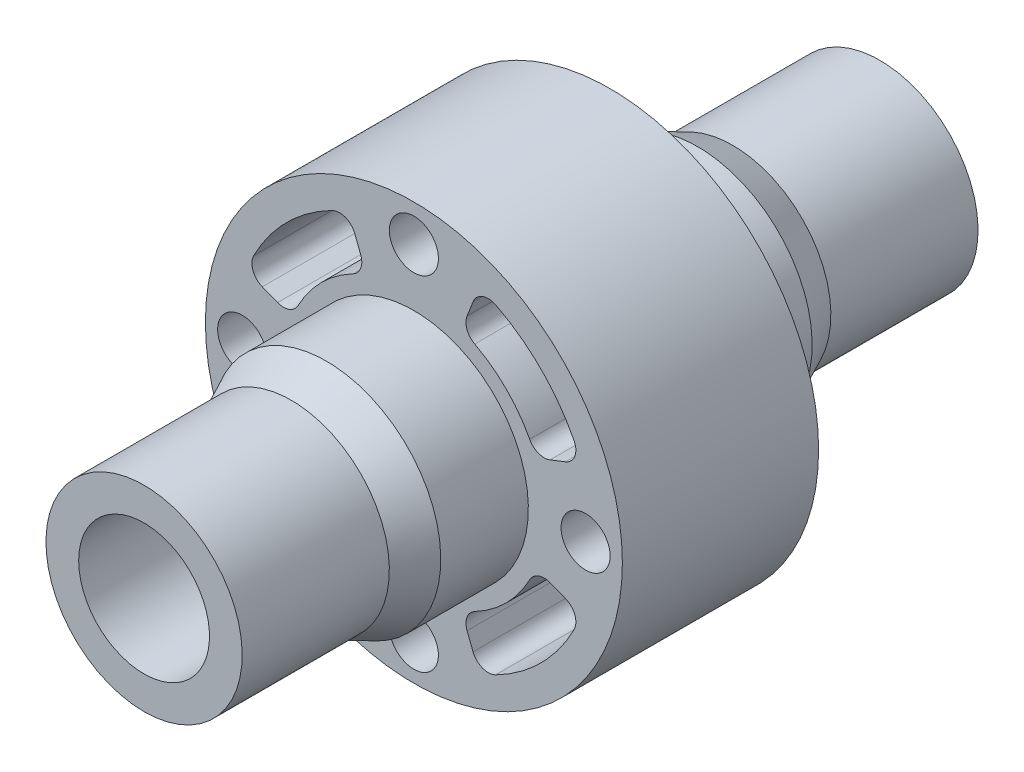
from build123d import *

# Parameters (mm, degrees)
SKETCH_2_R          = 1.5
CUT_EXTRUDE_1_DEPTH = 35.702305399
SKETCH_4_R          = 14
SKETCH_4_R_2        = 12.75
CUT_EXTRUDE_4_DEPTH = 35.702305399
CUT_EXTRUDE_5_DEPTH = 34.724990734
SKETCH_6_R          = 4
CUT_EXTRUDE_6_DEPTH = 49.478087834


with BuildPart() as part:
    # 草图1 → 旋转1 (revolve)
    with BuildSketch(Plane(origin=(0, 0, 0), x_dir=(0, 0, -1), z_dir=(1, 0, 0))):
        Polygon((-22.5, 0), (-22.5, 6), (-13.5, 6), (-11.355493079, 7), (-6, 7), (-6, 14), (6, 14), (6, 7), (11.355493079, 7), (13.5, 6), (22.5, 6), (22.5, 0), align=None)
    revolve(axis=Axis((0, 0, 22.5), (0, 0, -1)))

    # 草图2 → 切除-拉伸1 (cut, through all)
    with BuildSketch(Plane.XY.offset(6)):
        with Locations((0, 10.5)):
            Circle(SKETCH_2_R)
        with Locations((10.5, 0)):
            Circle(SKETCH_2_R)
        with Locations((0, -10.5)):
            Circle(SKETCH_2_R)
        with Locations((-10.5, 0)):
            Circle(SKETCH_2_R)
    extrude(amount=-CUT_EXTRUDE_1_DEPTH, mode=Mode.SUBTRACT)

    # 草图4 → 切除-拉伸4 (cut, through all)
    with BuildSketch(Plane(origin=(0, 0, -6), x_dir=(-1, 0, 0), z_dir=(0, 0, -1))):
        Circle(SKETCH_4_R)
        Circle(SKETCH_4_R_2, mode=Mode.SUBTRACT)
    extrude(amount=-CUT_EXTRUDE_4_DEPTH, mode=Mode.SUBTRACT)

    # 草图5 → 切除-拉伸5 (cut, through all)
    with BuildSketch(Plane(origin=(0, 0, -6), x_dir=(-1, 0, 0), z_dir=(0, 0, -1))):
        with BuildLine():
            Line((-9.26871571, 3.618136135), (-8.331955809, 3.252462513))
            ThreePointArc((-8.331955809, 3.252462513), (-7.618330669, 3.247249598), (-7.082950618, 3.719114215))
            ThreePointArc((-7.082950618, 3.719114215), (-5.656854249, 5.656854249), (-3.719114215, 7.082950618))
            ThreePointArc((-3.719114215, 7.082950618), (-3.247249598, 7.618330669), (-3.252462513, 8.331955809))
            Line((-3.252462513, 8.331955809), (-3.618136135, 9.26871571))
            ThreePointArc((-3.618136135, 9.26871571), (-4.194460373, 9.839863314), (-5.004644825, 9.795587281))
            ThreePointArc((-5.004644825, 9.795587281), (-7.778174593, 7.778174593), (-9.795587281, 5.004644825))
            ThreePointArc((-9.795587281, 5.004644825), (-9.839863314, 4.194460373), (-9.26871571, 3.618136135))
        make_face()
        with BuildLine():
            Line((3.618136135, 9.26871571), (3.252462513, 8.331955809))
            ThreePointArc((3.252462513, 8.331955809), (3.247249598, 7.618330669), (3.719114215, 7.082950618))
            ThreePointArc((3.719114215, 7.082950618), (5.656854249, 5.656854249), (7.082950618, 3.719114215))
            ThreePointArc((7.082950618, 3.719114215), (7.618330669, 3.247249598), (8.331955809, 3.252462513))
            Line((8.331955809, 3.252462513), (9.26871571, 3.618136135))
            ThreePointArc((9.26871571, 3.618136135), (9.839863314, 4.194460373), (9.795587281, 5.004644825))
            ThreePointArc((9.795587281, 5.004644825), (7.778174593, 7.778174593), (5.004644825, 9.795587281))
            ThreePointArc((5.004644825, 9.795587281), (4.194460373, 9.839863314), (3.618136135, 9.26871571))
        make_face()
        with BuildLine():
            Line((9.26871571, -3.618136135), (8.331955809, -3.252462513))
            ThreePointArc((8.331955809, -3.252462513), (7.618330669, -3.247249598), (7.082950618, -3.719114215))
            ThreePointArc((7.082950618, -3.719114215), (5.656854249, -5.656854249), (3.719114215, -7.082950618))
            ThreePointArc((3.719114215, -7.082950618), (3.247249598, -7.618330669), (3.252462513, -8.331955809))
            Line((3.252462513, -8.331955809), (3.618136135, -9.26871571))
            ThreePointArc((3.618136135, -9.26871571), (4.194460373, -9.839863314), (5.004644825, -9.795587281))
            ThreePointArc((5.004644825, -9.795587281), (7.778174593, -7.778174593), (9.795587281, -5.004644825))
            ThreePointArc((9.795587281, -5.004644825), (9.839863314, -4.194460373), (9.26871571, -3.618136135))
        make_face()
        with BuildLine():
            Line((-3.618136135, -9.26871571), (-3.252462513, -8.331955809))
            ThreePointArc((-3.252462513, -8.331955809), (-3.247249598, -7.618330669), (-3.719114215, -7.082950618))
            ThreePointArc((-3.719114215, -7.082950618), (-5.656854249, -5.656854249), (-7.082950618, -3.719114215))
            ThreePointArc((-7.082950618, -3.719114215), (-7.618330669, -3.247249598), (-8.331955809, -3.252462513))
            Line((-8.331955809, -3.252462513), (-9.26871571, -3.618136135))
            ThreePointArc((-9.26871571, -3.618136135), (-9.839863314, -4.194460373), (-9.795587281, -5.004644825))
            ThreePointArc((-9.795587281, -5.004644825), (-7.778174593, -7.778174593), (-5.004644825, -9.795587281))
            ThreePointArc((-5.004644825, -9.795587281), (-4.194460373, -9.839863314), (-3.618136135, -9.26871571))
        make_face()
    extrude(amount=-CUT_EXTRUDE_5_DEPTH, mode=Mode.SUBTRACT)

    # 草图6 → 切除-拉伸6 (cut, through all)
    with BuildSketch(Plane(origin=(0, 0, -22.5), x_dir=(-1, 0, 0), z_dir=(0, 0, -1))):
        Circle(SKETCH_6_R)
    extrude(amount=-CUT_EXTRUDE_6_DEPTH, mode=Mode.SUBTRACT)


solid = part.part
